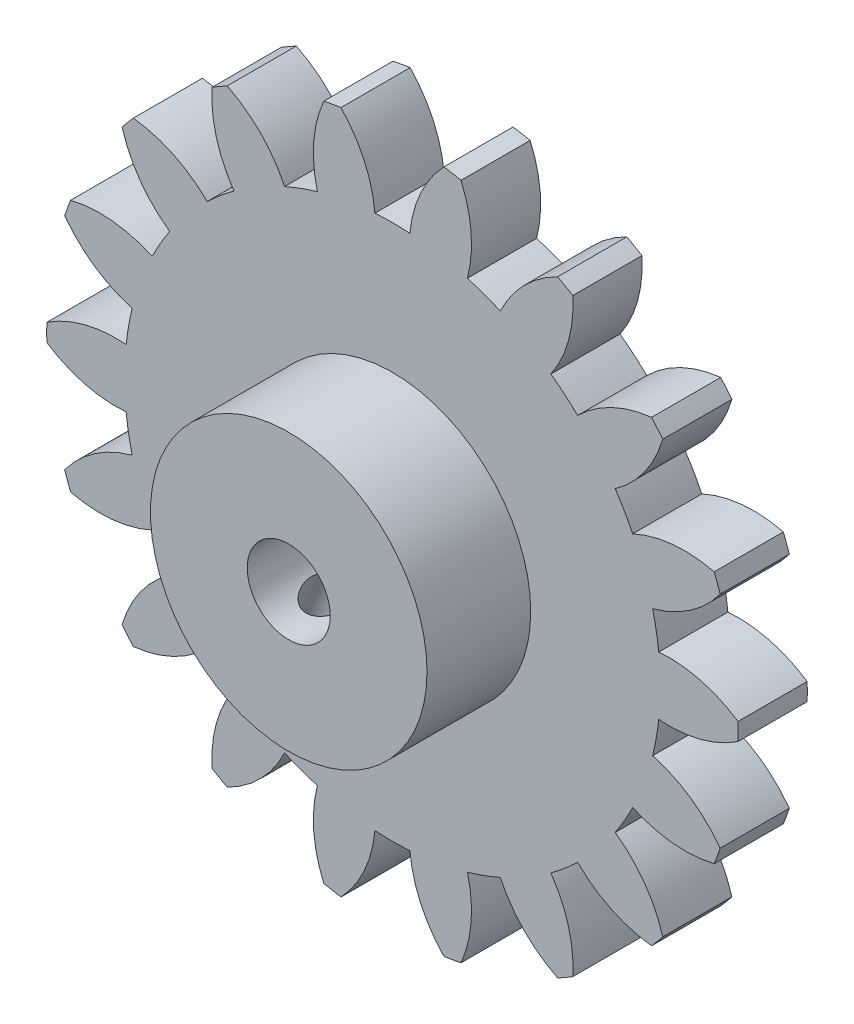
from build123d import *

# Parameters (mm, degrees)
SKETCH1_R           = 3
BOSS_EXTRUDE2_DEPTH = 5
SKETCH2_R           = 10
SKETCH2_R_2         = 3
BOSS_EXTRUDE3_DEPTH = 7.5


# Read off the part's stored shape, not the designer's step: CSK for M3 Flat Head Machine Screw1
with BuildPart() as part:
    # Sketch1 → Boss-Extrude2 (new body)
    with BuildSketch(Plane.XY):
        with BuildLine():
            ThreePointArc((-19.550519413, 15.581309017), (-18.238129642, 12.880402273), (-16.110253623, 10.761580005))
            ThreePointArc((-16.110253623, 10.761580005), (-16.778376173, 9.687), (-17.374928481, 8.571098896))
            ThreePointArc((-17.374928481, 8.571098896), (-20.2738204, 9.354482451), (-23.269069139, 9.14059196))
            ThreePointArc((-23.269069139, 9.14059196), (-23.49231552, 8.550503583), (-23.700600368, 7.954969654))
            ThreePointArc((-23.700600368, 7.954969654), (-21.543592873, 5.865811255), (-18.819363584, 4.602546066))
            ThreePointArc((-18.819363584, 4.602546066), (-19.079665407, 3.364259794), (-19.258580553, 2.111622855))
            ThreePointArc((-19.258580553, 2.111622855), (-22.250580854, 1.856283171), (-24.992039135, 0.630856452))
            ThreePointArc((-24.992039135, 0.630856452), (-25, 0), (-24.992039135, -0.630856452))
            ThreePointArc((-24.992039135, -0.630856452), (-22.250580854, -1.856283171), (-19.258580553, -2.111622855))
            ThreePointArc((-19.258580553, -2.111622855), (-19.079665407, -3.364259794), (-18.819363584, -4.602546066))
            ThreePointArc((-18.819363584, -4.602546066), (-21.543592873, -5.865811255), (-23.700600368, -7.954969654))
            ThreePointArc((-23.700600368, -7.954969654), (-23.49231552, -8.550503583), (-23.269069139, -9.14059196))
            ThreePointArc((-23.269069139, -9.14059196), (-20.2738204, -9.354482451), (-17.374928481, -8.571098896))
            ThreePointArc((-17.374928481, -8.571098896), (-16.778376173, -9.687), (-16.110253623, -10.761580005))
            ThreePointArc((-16.110253623, -10.761580005), (-18.238129642, -12.880402273), (-19.550519413, -15.581309017))
            ThreePointArc((-19.550519413, -15.581309017), (-19.151111078, -16.069690242), (-18.739505991, -16.547837177))
            ThreePointArc((-18.739505991, -16.547837177), (-15.851737997, -15.724393089), (-13.395603607, -13.996773914))
            ThreePointArc((-13.395603607, -13.996773914), (-12.45336715, -14.841345041), (-11.458009312, -15.622608572))
            ThreePointArc((-11.458009312, -15.622608572), (-12.73287881, -18.341426683), (-13.042357282, -21.328312557))
            ThreePointArc((-13.042357282, -21.328312557), (-12.5, -21.650635095), (-11.949681854, -21.95916901))
            ThreePointArc((-11.949681854, -21.95916901), (-9.517702044, -20.197709854), (-7.800571241, -17.734231427))
            ThreePointArc((-7.800571241, -17.734231427), (-6.626298257, -18.205604835), (-5.423759977, -18.59931998))
            ThreePointArc((-5.423759977, -18.59931998), (-5.691854876, -21.590204344), (-4.961094377, -24.502806831))
            ThreePointArc((-4.961094377, -24.502806831), (-4.341204442, -24.620193825), (-3.718549727, -24.721900977))
            ThreePointArc((-3.718549727, -24.721900977), (-2.035690758, -22.234884724), (-1.264674858, -19.332678901))
            ThreePointArc((-1.264674858, -19.332678901), (0, -19.374), (1.264674858, -19.332678901))
            ThreePointArc((1.264674858, -19.332678901), (2.035690758, -22.234884724), (3.718549727, -24.721900977))
            ThreePointArc((3.718549727, -24.721900977), (4.341204442, -24.620193825), (4.961094377, -24.502806831))
            ThreePointArc((4.961094377, -24.502806831), (5.691854876, -21.590204344), (5.423759977, -18.59931998))
            ThreePointArc((5.423759977, -18.59931998), (6.626298257, -18.205604835), (7.800571241, -17.734231427))
            ThreePointArc((7.800571241, -17.734231427), (9.517702044, -20.197709854), (11.949681854, -21.95916901))
            ThreePointArc((11.949681854, -21.95916901), (12.5, -21.650635095), (13.042357282, -21.328312557))
            ThreePointArc((13.042357282, -21.328312557), (12.73287881, -18.341426683), (11.458009312, -15.622608572))
            ThreePointArc((11.458009312, -15.622608572), (12.45336715, -14.841345041), (13.395603607, -13.996773914))
            ThreePointArc((13.395603607, -13.996773914), (15.851737997, -15.724393089), (18.739505991, -16.547837177))
            ThreePointArc((18.739505991, -16.547837177), (19.151111078, -16.069690242), (19.550519413, -15.581309017))
            ThreePointArc((19.550519413, -15.581309017), (18.238129642, -12.880402273), (16.110253623, -10.761580005))
            ThreePointArc((16.110253623, -10.761580005), (16.778376173, -9.687), (17.374928481, -8.571098896))
            ThreePointArc((17.374928481, -8.571098896), (20.2738204, -9.354482451), (23.269069139, -9.14059196))
            ThreePointArc((23.269069139, -9.14059196), (23.49231552, -8.550503583), (23.700600368, -7.954969654))
            ThreePointArc((23.700600368, -7.954969654), (21.543592873, -5.865811255), (18.819363584, -4.602546066))
            ThreePointArc((18.819363584, -4.602546066), (19.079665407, -3.364259794), (19.258580553, -2.111622855))
            ThreePointArc((19.258580553, -2.111622855), (22.250580854, -1.856283171), (24.992039135, -0.630856452))
            ThreePointArc((24.992039135, -0.630856452), (25, 0), (24.992039135, 0.630856452))
            ThreePointArc((24.992039135, 0.630856452), (22.250580854, 1.856283171), (19.258580553, 2.111622855))
            ThreePointArc((19.258580553, 2.111622855), (19.079665407, 3.364259794), (18.819363584, 4.602546066))
            ThreePointArc((18.819363584, 4.602546066), (21.543592873, 5.865811255), (23.700600368, 7.954969654))
            ThreePointArc((23.700600368, 7.954969654), (23.49231552, 8.550503583), (23.269069139, 9.14059196))
            ThreePointArc((23.269069139, 9.14059196), (20.2738204, 9.354482451), (17.374928481, 8.571098896))
            ThreePointArc((17.374928481, 8.571098896), (16.778376173, 9.687), (16.110253623, 10.761580005))
            ThreePointArc((16.110253623, 10.761580005), (18.238129642, 12.880402273), (19.550519413, 15.581309017))
            ThreePointArc((19.550519413, 15.581309017), (19.151111078, 16.069690242), (18.739505991, 16.547837177))
            ThreePointArc((18.739505991, 16.547837177), (15.851737997, 15.724393089), (13.395603607, 13.996773914))
            ThreePointArc((13.395603607, 13.996773914), (12.45336715, 14.841345041), (11.458009312, 15.622608572))
            ThreePointArc((11.458009312, 15.622608572), (12.73287881, 18.341426683), (13.042357282, 21.328312557))
            ThreePointArc((13.042357282, 21.328312557), (12.5, 21.650635095), (11.949681854, 21.95916901))
            ThreePointArc((11.949681854, 21.95916901), (9.517702044, 20.197709854), (7.800571241, 17.734231427))
            ThreePointArc((7.800571241, 17.734231427), (6.626298257, 18.205604835), (5.423759977, 18.59931998))
            ThreePointArc((5.423759977, 18.59931998), (5.691854876, 21.590204344), (4.961094377, 24.502806831))
            ThreePointArc((4.961094377, 24.502806831), (4.341204442, 24.620193825), (3.718549727, 24.721900977))
            ThreePointArc((3.718549727, 24.721900977), (2.035690758, 22.234884724), (1.264674858, 19.332678901))
            ThreePointArc((1.264674858, 19.332678901), (0, 19.374), (-1.264674858, 19.332678901))
            ThreePointArc((-1.264674858, 19.332678901), (-2.035690758, 22.234884724), (-3.718549727, 24.721900977))
            ThreePointArc((-3.718549727, 24.721900977), (-4.341204442, 24.620193825), (-4.961094377, 24.502806831))
            ThreePointArc((-4.961094377, 24.502806831), (-5.691854876, 21.590204344), (-5.423759977, 18.59931998))
            ThreePointArc((-5.423759977, 18.59931998), (-6.626298257, 18.205604835), (-7.800571241, 17.734231427))
            ThreePointArc((-7.800571241, 17.734231427), (-9.517702044, 20.197709854), (-11.949681854, 21.95916901))
            ThreePointArc((-11.949681854, 21.95916901), (-12.5, 21.650635095), (-13.042357282, 21.328312557))
            ThreePointArc((-13.042357282, 21.328312557), (-12.73287881, 18.341426683), (-11.458009312, 15.622608572))
            ThreePointArc((-11.458009312, 15.622608572), (-12.45336715, 14.841345041), (-13.395603607, 13.996773914))
            ThreePointArc((-13.395603607, 13.996773914), (-15.851737997, 15.724393089), (-18.739505991, 16.547837177))
            ThreePointArc((-18.739505991, 16.547837177), (-19.151111078, 16.069690242), (-19.550519413, 15.581309017))
        make_face()
        Circle(SKETCH1_R, mode=Mode.SUBTRACT)
    extrude(amount=BOSS_EXTRUDE2_DEPTH)

    # Sketch2 → Boss-Extrude3 (add)
    with BuildSketch(Plane.XY.offset(5)):
        Circle(SKETCH2_R)
        Circle(SKETCH2_R_2, mode=Mode.SUBTRACT)
    extrude(amount=BOSS_EXTRUDE3_DEPTH)

    # CSK for M3 Flat Head Machine Screw1 outl → CSK for M3 Flat Head Machine Screw1 (revolve, cut)
    with BuildSketch(Plane(origin=(0, 0, 8.675124241), x_dir=(0.9261648448832729, -0.37711892037173506, 0), z_dir=(0, 0, 1))):
        Polygon((3.150067458, -10.000067458), (1.7, -8.55), (1.7, -3), (1.247536555, -2.728132535), (0, -2.728132535), (0, -10.000067458), align=None)
    revolve(axis=Axis((0, 0, 8.675124241), (0.37711892037173506, 0.9261648448832729, 0)), mode=Mode.SUBTRACT)


solid = part.part
